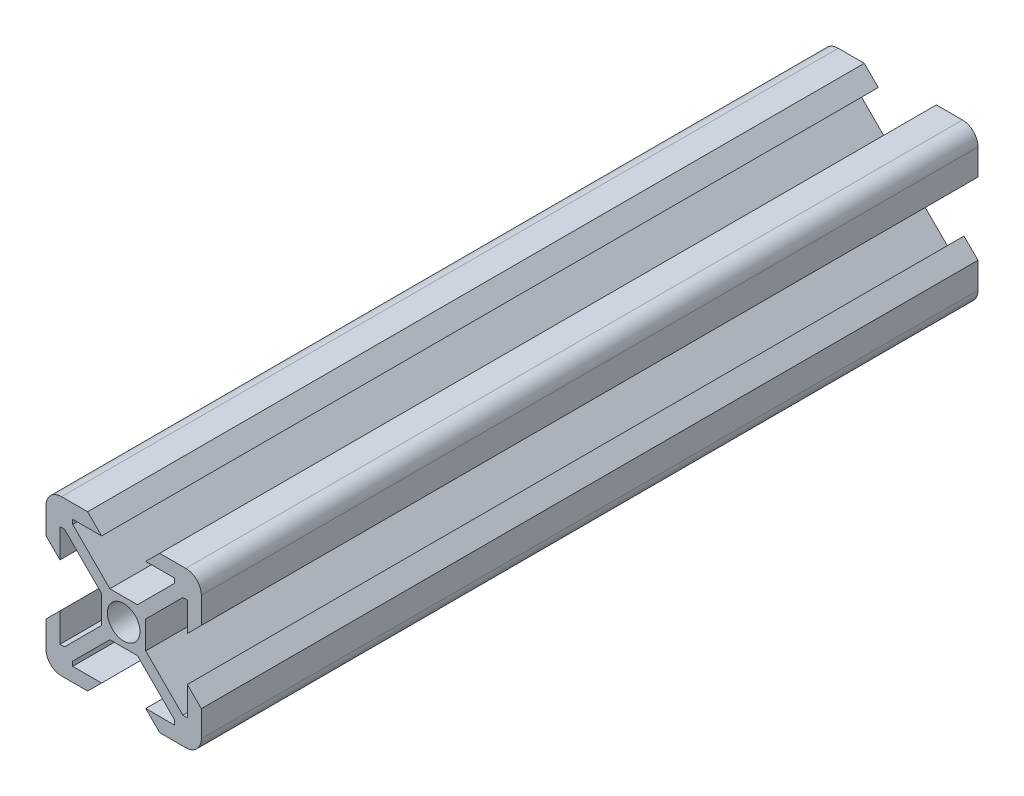
from build123d import *

# Parameters (mm, degrees)
SKETCH1_R           = 2.1
BOSS_EXTRUDE1_DEPTH = 100


with BuildPart() as part:
    # Sketch1 → Boss-Extrude1 (new body)
    with BuildSketch(Plane.XY):
        with BuildLine():
            ThreePointArc((10, 8), (9.414213562, 9.414213562), (8, 10))
            Line((8, 10), (4.64, 10))
            Line((4.64, 10), (2.84, 8.2))
            Line((2.84, 8.2), (6.56, 8.2))
            Line((6.56, 8.2), (6.56, 7.620660172))
            Line((6.56, 7.620660172), (1.779339828, 2.84))
            Line((1.779339828, 2.84), (-1.779339828, 2.84))
            Line((-1.779339828, 2.84), (-6.56, 7.620660172))
            Line((-6.56, 7.620660172), (-6.56, 8.2))
            Line((-6.56, 8.2), (-2.84, 8.2))
            Line((-2.84, 8.2), (-4.64, 10))
            Line((-4.64, 10), (-8, 10))
            ThreePointArc((-8, 10), (-9.414213562, 9.414213562), (-10, 8))
            Line((-10, 8), (-10, 4.64))
            Line((-10, 4.64), (-8.2, 2.84))
            Line((-8.2, 2.84), (-8.2, 6.56))
            Line((-8.2, 6.56), (-7.620660172, 6.56))
            Line((-7.620660172, 6.56), (-2.84, 1.779339828))
            Line((-2.84, 1.779339828), (-2.84, -1.779339828))
            Line((-2.84, -1.779339828), (-7.620660172, -6.56))
            Line((-7.620660172, -6.56), (-8.2, -6.56))
            Line((-8.2, -6.56), (-8.2, -2.84))
            Line((-8.2, -2.84), (-10, -4.64))
            Line((-10, -4.64), (-10, -8))
            ThreePointArc((-10, -8), (-9.414213562, -9.414213562), (-8, -10))
            Line((-8, -10), (-4.64, -10))
            Line((-4.64, -10), (-2.84, -8.2))
            Line((-2.84, -8.2), (-6.56, -8.2))
            Line((-6.56, -8.2), (-6.56, -7.620660172))
            Line((-6.56, -7.620660172), (-1.779339828, -2.84))
            Line((-1.779339828, -2.84), (1.779339828, -2.84))
            Line((1.779339828, -2.84), (6.56, -7.620660172))
            Line((6.56, -7.620660172), (6.56, -8.2))
            Line((6.56, -8.2), (2.84, -8.2))
            Line((2.84, -8.2), (4.64, -10))
            Line((4.64, -10), (8, -10))
            ThreePointArc((8, -10), (9.414213562, -9.414213562), (10, -8))
            Line((10, -8), (10, -4.64))
            Line((10, -4.64), (8.2, -2.84))
            Line((8.2, -2.84), (8.2, -6.56))
            Line((8.2, -6.56), (7.620660172, -6.56))
            Line((7.620660172, -6.56), (2.84, -1.779339828))
            Line((2.84, -1.779339828), (2.84, 1.779339828))
            Line((2.84, 1.779339828), (7.620660172, 6.56))
            Line((7.620660172, 6.56), (8.2, 6.56))
            Line((8.2, 6.56), (8.2, 2.84))
            Line((8.2, 2.84), (10, 4.64))
            Line((10, 4.64), (10, 8))
        make_face()
        Circle(SKETCH1_R, mode=Mode.SUBTRACT)
    extrude(amount=BOSS_EXTRUDE1_DEPTH)


solid = part.part
